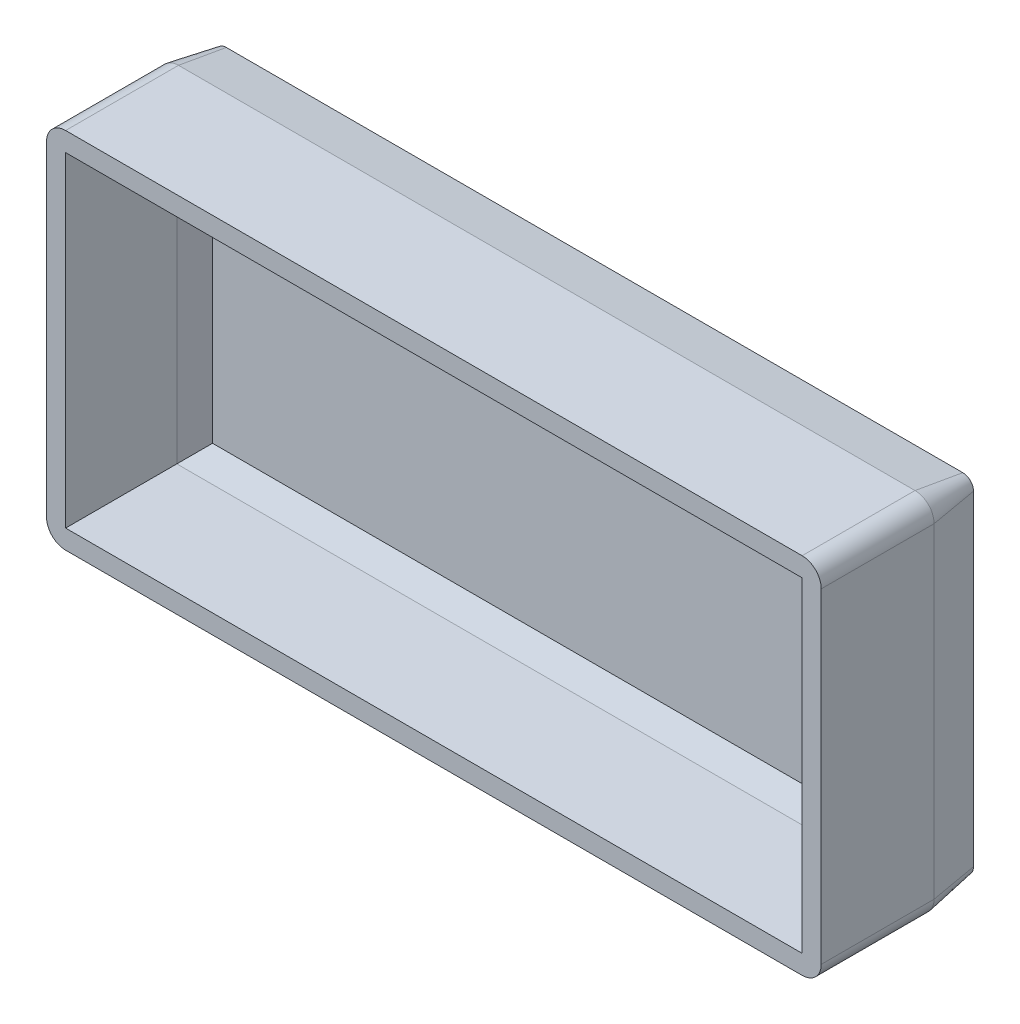
from build123d import *

# Parameters (mm, degrees)
SALIENTE_EXTRUIR1_DEPTH = 5.9
SALIENTE_EXTRUIR2_DEPTH = 2.5
SALIENTE_EXTRUIR2_DRAFT = -10
VACIADO1_START          = -8.5
VACIADO1_DEPTH          = 17
VACIADO1_START_2        = -19.25
VACIADO1_2_DEPTH        = 38.5
SKETCH1_R               = 3.5
BOSS_EXTRUDE1_DEPTH     = 0.5
SKETCH2_R               = 2.65
SKETCH2_R_2             = 1.8
BOSS_EXTRUDE2_DEPTH     = 4
SKETCH3_R               = 0.55
CUT_EXTRUDE1_DEPTH      = 10


with BuildPart() as part:
    # Croquis1 → Saliente-Extruir1 (new body)
    with BuildSketch(Plane.XY):
        with BuildLine():
            Line((-20.25, 8.5), (-20.25, -8.5))
            ThreePointArc((-20.25, -8.5), (-19.957106781, -9.207106781), (-19.25, -9.5))
            Line((-19.25, -9.5), (19.25, -9.5))
            ThreePointArc((19.25, -9.5), (19.957106781, -9.207106781), (20.25, -8.5))
            Line((20.25, -8.5), (20.25, 8.5))
            ThreePointArc((20.25, 8.5), (19.957106781, 9.207106781), (19.25, 9.5))
            Line((19.25, 9.5), (-19.25, 9.5))
            ThreePointArc((-19.25, 9.5), (-19.957106781, 9.207106781), (-20.25, 8.5))
        make_face()
    extrude(amount=SALIENTE_EXTRUIR1_DEPTH)


with BuildPart() as saliente_extruir2_tool:
    # Croquis1<2> → Saliente-Extruir2 (with draft: the straight prism first)
    with BuildSketch(Plane.XY):
        with BuildLine():
            Line((-20.25, 8.5), (-20.25, -8.5))
            ThreePointArc((-20.25, -8.5), (-19.957106781, -9.207106781), (-19.25, -9.5))
            Line((-19.25, -9.5), (19.25, -9.5))
            ThreePointArc((19.25, -9.5), (19.957106781, -9.207106781), (20.25, -8.5))
            Line((20.25, -8.5), (20.25, 8.5))
            ThreePointArc((20.25, 8.5), (19.957106781, 9.207106781), (19.25, 9.5))
            Line((19.25, 9.5), (-19.25, 9.5))
            ThreePointArc((-19.25, 9.5), (-19.957106781, 9.207106781), (-20.25, 8.5))
        make_face()
    extrude(amount=-SALIENTE_EXTRUIR2_DEPTH)
    # Saliente-Extruir2: the draft: its side faces are tilted about the plane it starts from
    saliente_extruir2_sides = [saliente_extruir2_tool.faces().sort_by_distance(p)[0] for p in [
        (0, 9.5, -1.25),
        (-19.957106781, 9.207106781, -1.25),
        (-20.25, 0, -1.25),
        (-19.957106781, -9.207106781, -1.25),
        (0, -9.5, -1.25),
        (19.957106781, -9.207106781, -1.25),
        (20.25, 0, -1.25),
        (19.957106781, 9.207106781, -1.25),
    ]]
    draft(saliente_extruir2_sides, Plane.XY, SALIENTE_EXTRUIR2_DRAFT)


with BuildPart() as part_1:
    add(part.part)

    # Saliente-Extruir2: add saliente_extruir2_tool
    add(saliente_extruir2_tool.part)

    # Vaciado1: read off the stored shape, not the designer's step
    # Vaciado1 outline → Vaciado1 (cut)
    with BuildSketch(Plane(origin=(0, 0, 0), x_dir=(1, 0, 0), z_dir=(0, 1, 0)).offset(VACIADO1_START)):
        Polygon((-19.25, -0.087488664), (-19.25, -5.9), (19.25, -5.9), (19.25, -0.087488664), (18.970082917, 1.5), (-18.970082917, 1.5), align=None)
    extrude(amount=VACIADO1_DEPTH, mode=Mode.SUBTRACT)

    # Vaciado1 2 outline → Vaciado1 2 (add)
    with BuildSketch(Plane.YZ.offset(VACIADO1_START_2)):
        Polygon((8.5, 0.087488664), (8.220082917, -1.5), (8.5, -1.5), align=None)
        Polygon((-8.220082917, -1.5), (-8.5, 0.087488664), (-8.5, -1.5), align=None)
    extrude(amount=VACIADO1_2_DEPTH)

    # Sketch1 → Boss-Extrude1 (add)
    with BuildSketch(Plane(origin=(0, 0, -2.5), x_dir=(-1, 0, 0), z_dir=(0, 0, -1))):
        with Locations(Location((10.95, 0, 0), (0, 0, 180))):
            Circle(SKETCH1_R)
    extrude(amount=BOSS_EXTRUDE1_DEPTH)

    # Sketch2 → Boss-Extrude2 (add)
    with BuildSketch(Plane(origin=(0, 0, -3), x_dir=(-1, 0, 0), z_dir=(0, 0, -1))):
        with Locations((10.95, 0)):
            Circle(SKETCH2_R)
        with Locations((10.95, 0)):
            Circle(SKETCH2_R_2, mode=Mode.SUBTRACT)
    extrude(amount=BOSS_EXTRUDE2_DEPTH)

    # Sketch3 → Cut-Extrude1 (cut)
    with BuildSketch(Plane(origin=(0, 0, -2.5), x_dir=(-1, 0, 0), z_dir=(0, 0, -1))):
        with Locations((-18.309182548, -7.559182548)):
            Circle(SKETCH3_R)
        with Locations(Location((-18.309182548, 7.559182548, 0), (0, 0, 180))):
            Circle(SKETCH3_R)
    extrude(amount=-CUT_EXTRUDE1_DEPTH, mode=Mode.SUBTRACT)


solid = part_1.part
